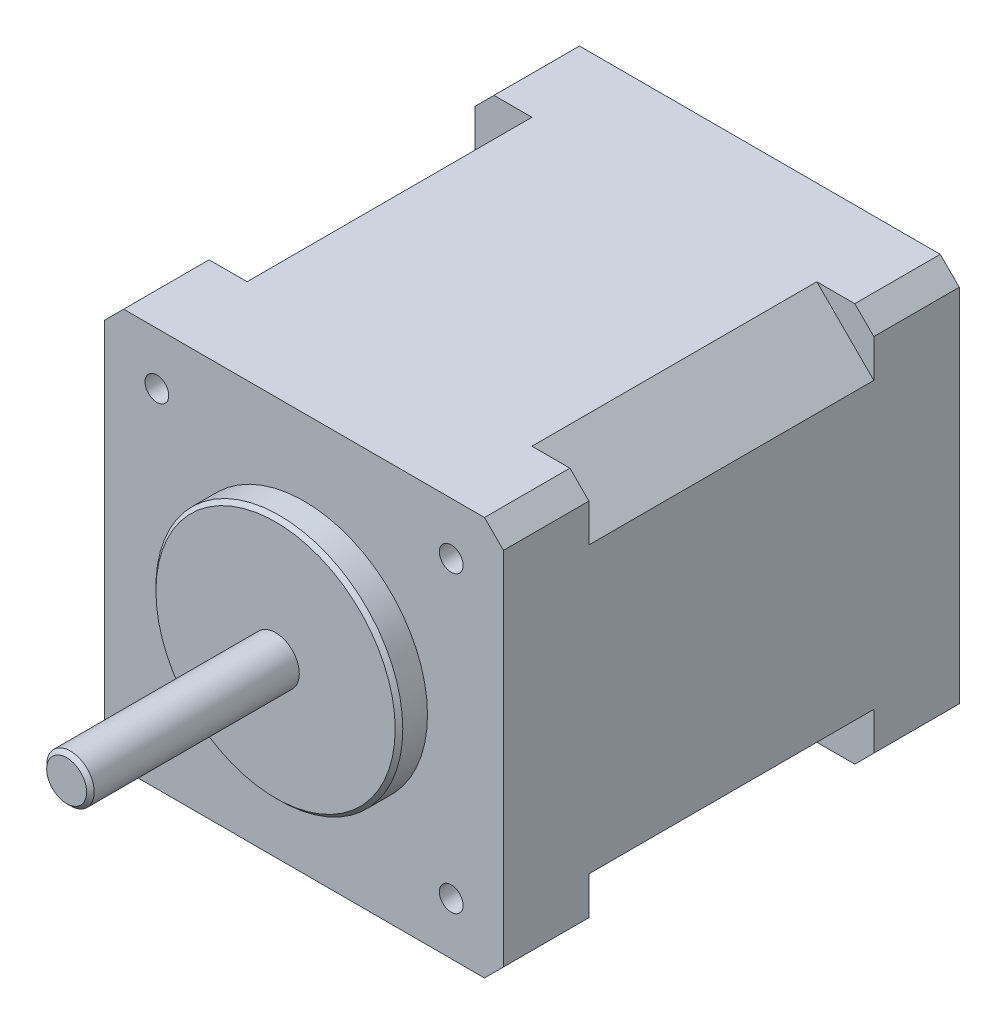
from build123d import *

# Parameters (mm, degrees)
ESQUISSE1_W                               = 42
ESQUISSE1_H                               = 42
BOSS_EXTRU_1_DEPTH                        = 48
CHANFREIN1_SIZE                           = 2
ESQUISSE3_R                               = 13
BOSS_EXTRU_2_DEPTH                        = 3
TROU_POUR_TARAUDAGE_POUR_TROU_TARAUD_M3_D = 2.5
ESQUISSE7_R                               = 2.5
BOSS_EXTRU_3_DEPTH                        = 22
CHANFREIN2_SIZE                           = 0.4
CHANFREIN3_SIZE                           = 0.4
ENL_V_START                               = -9
ENL_V_MAT_EXTRU_1_DEPTH                   = 30


with BuildPart() as part:
    # Esquisse1 → Boss.-Extru.1 (new body)
    with BuildSketch(Plane.XY):
        Rectangle(ESQUISSE1_W, ESQUISSE1_H)
    extrude(amount=BOSS_EXTRU_1_DEPTH)

    # Chanfrein1
    chanfrein1_edges = [part.edges().sort_by_distance(p)[0] for p in [
        (-21, -21, 24),
        (21, -21, 24),
        (-21, 21, 24),
        (21, 21, 24),
    ]]
    chamfer(chanfrein1_edges, length=CHANFREIN1_SIZE)

    # Esquisse3 → Boss.-Extru.2 (add)
    with BuildSketch(Plane.XY.offset(48)):
        Circle(ESQUISSE3_R)
    extrude(amount=BOSS_EXTRU_2_DEPTH)

    # Trou pour taraudage pour trou taraudé M3x0.51 (through all)
    with Locations(Plane.XY.offset(48)):
        with Locations((-15.5, 15.5), (-15.5, -15.5), (15.5, -15.5), (15.5, 15.5)):
            Hole(TROU_POUR_TARAUDAGE_POUR_TROU_TARAUD_M3_D / 2)

    # Esquisse7 → Boss.-Extru.3 (add)
    with BuildSketch(Plane.XY.offset(51)):
        Circle(ESQUISSE7_R)
    extrude(amount=BOSS_EXTRU_3_DEPTH)

    # Chanfrein2
    chanfrein2_edges = [part.edges().sort_by_distance(p)[0] for p in [
        (-2.5, 0, 73),
    ]]
    chamfer(chanfrein2_edges, length=CHANFREIN2_SIZE)

    # Chanfrein3
    chanfrein3_edges = [part.edges().sort_by_distance(p)[0] for p in [
        (-13, 0, 51),
    ]]
    chamfer(chanfrein3_edges, length=CHANFREIN3_SIZE)

    # Esquisse9 → Enlèv. mat.-Extru.1 (cut)
    with BuildSketch(Plane(origin=(0, 0, 0), x_dir=(-1, 0, 0), z_dir=(0, 0, -1)).offset(ENL_V_START)):
        Polygon((-21, 15), (-15, 21), (-21, 21), align=None)
        Polygon((15, 21), (21, 15), (21, 21), align=None)
        Polygon((-21, -15), (-15, -21), (-21, -21), align=None)
        Polygon((15, -21), (21, -15), (21, -21), align=None)
    extrude(amount=-ENL_V_MAT_EXTRU_1_DEPTH, mode=Mode.SUBTRACT)


solid = part.part
